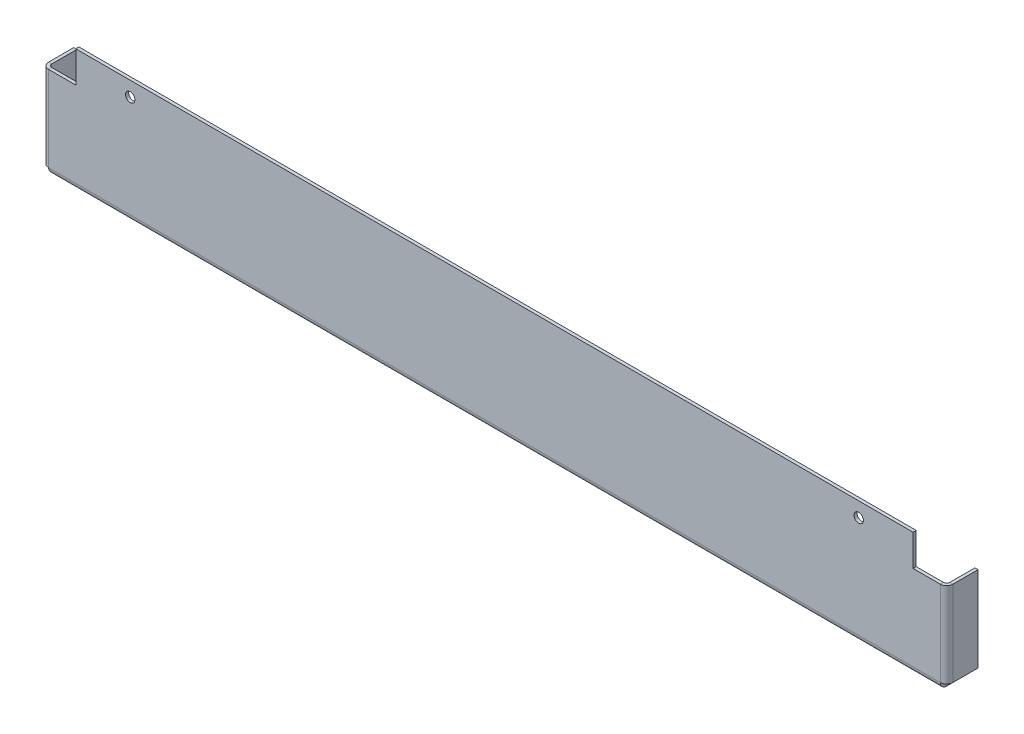
from build123d import *

# Parameters (mm, degrees)
SKETCH_1_W             = 426
SKETCH_1_H             = 55.7
SM_BASE_FLANGE_1_DEPTH = 1.5
SM_EDGE_FLANGE_2_DEPTH = 55.7
SM_EDGE_FLANGE_3_DEPTH = 426
SM_EDGE_FLANGE_4_DEPTH = 55.7
SKETCH_25_W            = 15
SKETCH_25_H            = 15
CUT_EXTRUDE_1_DEPTH    = 16
SKETCH_26_W            = 15
SKETCH_26_H            = 15
CUT_EXTRUDE_2_DEPTH    = 16
SKETCH_27_R            = 2.25
CUT_EXTRUDE_3_DEPTH    = 433.860820588


# Sheet-metal steps are written as plain solids
with BuildPart() as part:
    # Sketch 1 → Базовая кромка1 (new body)
    with BuildSketch(Plane.XY):
        with Locations((213, 27.85)):
            Rectangle(SKETCH_1_W, SKETCH_1_H)
    extrude(amount=-SM_BASE_FLANGE_1_DEPTH)

    # Ребро-кромка2 section (across the edge) → Ребро-кромка2 (add)
    with BuildSketch(Plane(origin=(-1.5, 0, -1.5), x_dir=(1, 0, 0), z_dir=(0, 1, 0))):
        with BuildLine():
            Line((-1.5, 1.5), (-1.5, 13.5))
            Line((-1.5, 13.5), (0, 13.5))
            Line((0, 13.5), (0, 1.5))
            ThreePointArc((0, 1.5), (0.439339828, 0.439339828), (1.5, 0))
            Line((1.5, 0), (1.5, -1.5))
            ThreePointArc((1.5, -1.5), (-0.621320344, -0.621320344), (-1.5, 1.5))
        make_face()
    extrude(amount=SM_EDGE_FLANGE_2_DEPTH)

    # Ребро-кромка3 section (across the edge) → Ребро-кромка3 (add)
    with BuildSketch(Plane(origin=(426, -1.5, -1.5), x_dir=(0, 1, 0), z_dir=(-1, 0, 0))):
        with BuildLine():
            Line((-1.5, 1.5), (-1.5, 13.5))
            Line((-1.5, 13.5), (0, 13.5))
            Line((0, 13.5), (0, 1.5))
            ThreePointArc((0, 1.5), (0.439339828, 0.439339828), (1.5, 0))
            Line((1.5, 0), (1.5, -1.5))
            ThreePointArc((1.5, -1.5), (-0.621320344, -0.621320344), (-1.5, 1.5))
        make_face()
    extrude(amount=SM_EDGE_FLANGE_3_DEPTH)

    # Ребро-кромка4 section (across the edge) → Ребро-кромка4 (add)
    with BuildSketch(Plane(origin=(427.5, 55.7, -1.5), x_dir=(-1, 0, 0), z_dir=(0, -1, 0))):
        with BuildLine():
            Line((-1.5, 1.5), (-1.5, 13.5))
            Line((-1.5, 13.5), (0, 13.5))
            Line((0, 13.5), (0, 1.5))
            ThreePointArc((0, 1.5), (0.439339828, 0.439339828), (1.5, 0))
            Line((1.5, 0), (1.5, -1.5))
            ThreePointArc((1.5, -1.5), (-0.621320344, -0.621320344), (-1.5, 1.5))
        make_face()
    extrude(amount=SM_EDGE_FLANGE_4_DEPTH)

    # Эскиз25 → Вырез-Вытянуть1 (cut)
    with BuildSketch(Plane.ZY.offset(3)):
        with Locations((-7.5, 48.2)):
            Rectangle(SKETCH_25_W, SKETCH_25_H)
    extrude(amount=-CUT_EXTRUDE_1_DEPTH, mode=Mode.SUBTRACT)

    # Эскиз26 → Вырез-Вытянуть2 (cut)
    with BuildSketch(Plane(origin=(429, 0, 0), x_dir=(0, 0, -1), z_dir=(1, 0, 0))):
        with Locations((7.5, 48.2)):
            Rectangle(SKETCH_26_W, SKETCH_26_H)
    extrude(amount=-CUT_EXTRUDE_2_DEPTH, mode=Mode.SUBTRACT)

    # Эскиз27 → Вырез-Вытянуть3 (cut, through all)
    with BuildSketch(Plane.XY):
        with Locations((39, 48.7)):
            Circle(SKETCH_27_R)
        with Locations((387, 48.7)):
            Circle(SKETCH_27_R)
    extrude(amount=-CUT_EXTRUDE_3_DEPTH, mode=Mode.SUBTRACT)


solid = part.part
